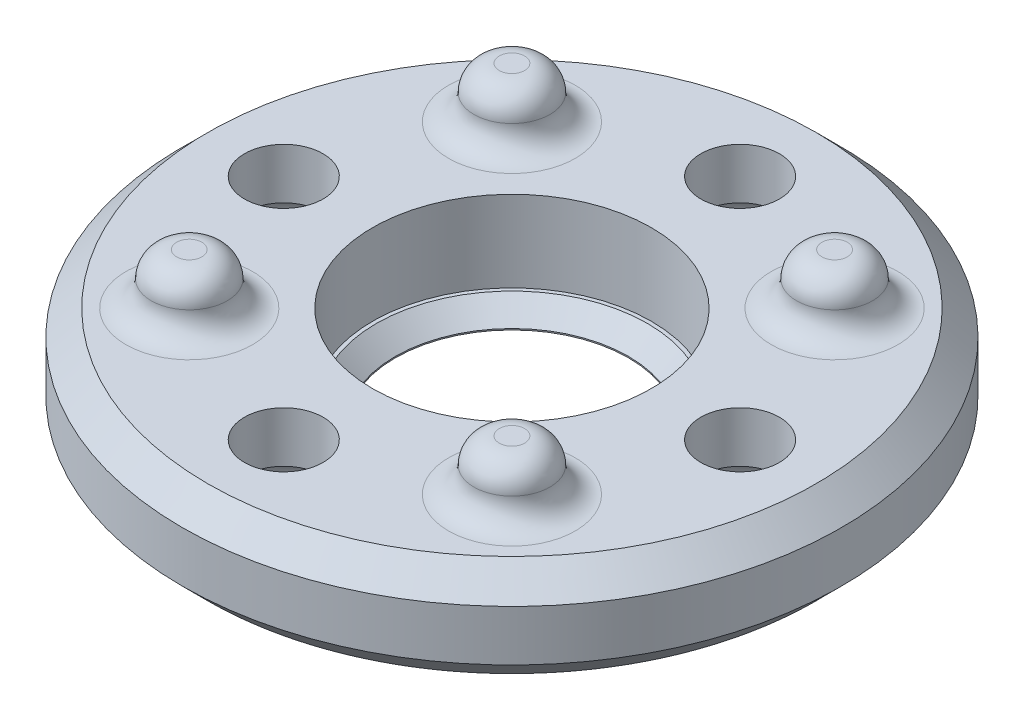
from build123d import *

# Parameters (mm, degrees)
SKETCH1_R           = 13
SKETCH1_R_2         = 5.5
BOSS_EXTRUDE1_DEPTH = 4
SKETCH2_R           = 1.55
CUT_EXTRUDE1_DEPTH  = 19.814887722
SKETCH3_R           = 3
CUT_EXTRUDE2_DEPTH  = 2
FILLET1_R           = 1.5
CHAMFER1_SIZE       = 1
CHAMFER2_SIZE       = 1
SKETCH4_R           = 1.5
BOSS_EXTRUDE2_DEPTH = 2
FILLET2_R           = 1
SKETCH5_R           = 5.5
SKETCH5_R_2         = 4.6
BOSS_EXTRUDE3_DEPTH = 0.8
CHAMFER3_SIZE       = 0.75


# Some blends are built 0.0001 mm under size
with BuildPart() as part:
    # Sketch1 → Boss-Extrude1 (new body)
    with BuildSketch(Plane(origin=(0, 0, 0), x_dir=(1, 0, 0), z_dir=(0, 1, 0))):
        with Locations(Location((0, 0, 0), (0, 0, 270))):
            Circle(SKETCH1_R)
        with Locations(Location((0, 0, 0), (0, 0, 270))):
            Circle(SKETCH1_R_2, mode=Mode.SUBTRACT)
    extrude(amount=BOSS_EXTRUDE1_DEPTH)

    # Sketch2 → Cut-Extrude1 (cut, through all)
    with BuildSketch(Plane.XZ):
        with Locations(Location((0, 9, 0), (0, 0, 270))):
            Circle(SKETCH2_R)
        with Locations(Location((9, 0, 0), (0, 0, 270))):
            Circle(SKETCH2_R)
        with Locations(Location((0, -9, 0), (0, 0, 270))):
            Circle(SKETCH2_R)
        with Locations(Location((-9, 0, 0), (0, 0, 270))):
            Circle(SKETCH2_R)
    extrude(amount=-CUT_EXTRUDE1_DEPTH, mode=Mode.SUBTRACT)

    # Sketch3 → Cut-Extrude2 (cut)
    with BuildSketch(Plane.XZ):
        with Locations(Location((0, 9, 0), (0, 0, 270))):
            Circle(SKETCH3_R)
        with Locations(Location((9, 0, 0), (0, 0, 270))):
            Circle(SKETCH3_R)
        with Locations(Location((0, -9, 0), (0, 0, 270))):
            Circle(SKETCH3_R)
        with Locations(Location((-9, 0, 0), (0, 0, 270))):
            Circle(SKETCH3_R)
    extrude(amount=-CUT_EXTRUDE2_DEPTH, mode=Mode.SUBTRACT)

    # Fillet1
    # the kernel refuses this fillet: 1.5 mm, written as the material it adds along each edge
    with BuildSketch(Plane(origin=(0, 2, 9), x_dir=(0, 0, -1), z_dir=(-1, 0, 0))) as fillet1_piece_1_section:
        with BuildLine():
            CenterArc((3 - FILLET1_R, FILLET1_R), FILLET1_R, 270, 90)
            Line((3 - FILLET1_R, 0), (3, 0))
            Line((3, 0), (3, FILLET1_R))
        make_face()
    fillet1_piece_1 = revolve(axis=Axis((0, 2, 9), (0, -1, 0)), mode=Mode.PRIVATE)
    fillet1_piece_1 = fillet1_piece_1 - Plane(origin=(0, 1.557596164, 9), x_dir=(0, 0, -1), z_dir=(0, -1, 0)) * Cylinder(1.55, 12, mode=Mode.PRIVATE)
    add(fillet1_piece_1)
    with BuildSketch(Plane(origin=(9, 2, 0), x_dir=(0, 0, -1), z_dir=(-1, 0, 0))) as fillet1_piece_2_section:
        with BuildLine():
            CenterArc((3 - FILLET1_R, FILLET1_R), FILLET1_R, 270, 90)
            Line((3 - FILLET1_R, 0), (3, 0))
            Line((3, 0), (3, FILLET1_R))
        make_face()
    fillet1_piece_2 = revolve(axis=Axis((9, 2, 0), (0, -1, 0)), mode=Mode.PRIVATE)
    fillet1_piece_2 = fillet1_piece_2 - Plane(origin=(9, 1.557596164, 0), x_dir=(0, 0, -1), z_dir=(0, -1, 0)) * Cylinder(1.55, 13, mode=Mode.PRIVATE)
    add(fillet1_piece_2)
    with BuildSketch(Plane(origin=(0, 2, -9), x_dir=(0, 0, -1), z_dir=(-1, 0, 0))) as fillet1_piece_3_section:
        with BuildLine():
            CenterArc((3 - FILLET1_R, FILLET1_R), FILLET1_R, 270, 90)
            Line((3 - FILLET1_R, 0), (3, 0))
            Line((3, 0), (3, FILLET1_R))
        make_face()
    fillet1_piece_3 = revolve(axis=Axis((0, 2, -9), (0, -1, 0)), mode=Mode.PRIVATE)
    fillet1_piece_3 = fillet1_piece_3 - Plane(origin=(0, 1.557596164, -9), x_dir=(0, 0, -1), z_dir=(0, -1, 0)) * Cylinder(1.55, 12, mode=Mode.PRIVATE)
    add(fillet1_piece_3)
    with BuildSketch(Plane(origin=(-9, 2, 0), x_dir=(0, 0, -1), z_dir=(-1, 0, 0))) as fillet1_piece_4_section:
        with BuildLine():
            CenterArc((3 - FILLET1_R, FILLET1_R), FILLET1_R, 270, 90)
            Line((3 - FILLET1_R, 0), (3, 0))
            Line((3, 0), (3, FILLET1_R))
        make_face()
    fillet1_piece_4 = revolve(axis=Axis((-9, 2, 0), (0, -1, 0)), mode=Mode.PRIVATE)
    fillet1_piece_4 = fillet1_piece_4 - Plane(origin=(-9, 1.557596164, 0), x_dir=(0, 0, -1), z_dir=(0, -1, 0)) * Cylinder(1.55, 12, mode=Mode.PRIVATE)
    add(fillet1_piece_4)

    # Chamfer1
    chamfer1_edges = [part.edges().sort_by_distance(p)[0] for p in [
        (0, 4, -13),
    ]]
    chamfer(chamfer1_edges, length=CHAMFER1_SIZE)

    # Chamfer2
    chamfer2_edges = [part.edges().sort_by_distance(p)[0] for p in [
        (0, 0, -13),
    ]]
    chamfer(chamfer2_edges, length=CHAMFER2_SIZE - 0.0001)  # a hair under: the kernel refuses the full size

    # Sketch4 → Boss-Extrude2 (add)
    with BuildSketch(Plane(origin=(0, 4, 0), x_dir=(1, 0, 0), z_dir=(0, 1, 0))):
        with Locations(Location((6.363961031, 6.363961031, 0), (0, 0, 270))):
            Circle(SKETCH4_R)
        with Locations(Location((6.363961031, -6.363961031, 0), (0, 0, 270))):
            Circle(SKETCH4_R)
        with Locations(Location((-6.363961031, -6.363961031, 0), (0, 0, 270))):
            Circle(SKETCH4_R)
        with Locations(Location((-6.363961031, 6.363961031, 0), (0, 0, 270))):
            Circle(SKETCH4_R)
    extrude(amount=BOSS_EXTRUDE2_DEPTH)

    # Fillet2
    fillet2_edges = [part.edges().sort_by_distance(p)[0] for p in [
        (6.363961031, 4, -7.863961031),
        (6.363961031, 6, -7.863961031),
        (6.363961031, 4, 4.863961031),
        (6.363961031, 6, 4.863961031),
        (-6.363961031, 4, 4.863961031),
        (-6.363961031, 6, 4.863961031),
        (-6.363961031, 4, -7.863961031),
        (-6.363961031, 6, -7.863961031),
    ]]
    fillet(fillet2_edges, radius=FILLET2_R - 0.0001)  # a hair under: the kernel refuses the full size

    # Sketch5 → Boss-Extrude3 (add)
    with BuildSketch(Plane.XZ):
        with Locations(Location((0, 0, 0), (0, 0, 270))):
            Circle(SKETCH5_R)
        with Locations(Location((0, 0, 0), (0, 0, 270))):
            Circle(SKETCH5_R_2, mode=Mode.SUBTRACT)
    extrude(amount=-BOSS_EXTRUDE3_DEPTH)

    # Chamfer3
    chamfer3_edges = [part.edges().sort_by_distance(p)[0] for p in [
        (0, 0.8, 4.6),
    ]]
    chamfer(chamfer3_edges, length=CHAMFER3_SIZE)


solid = part.part
